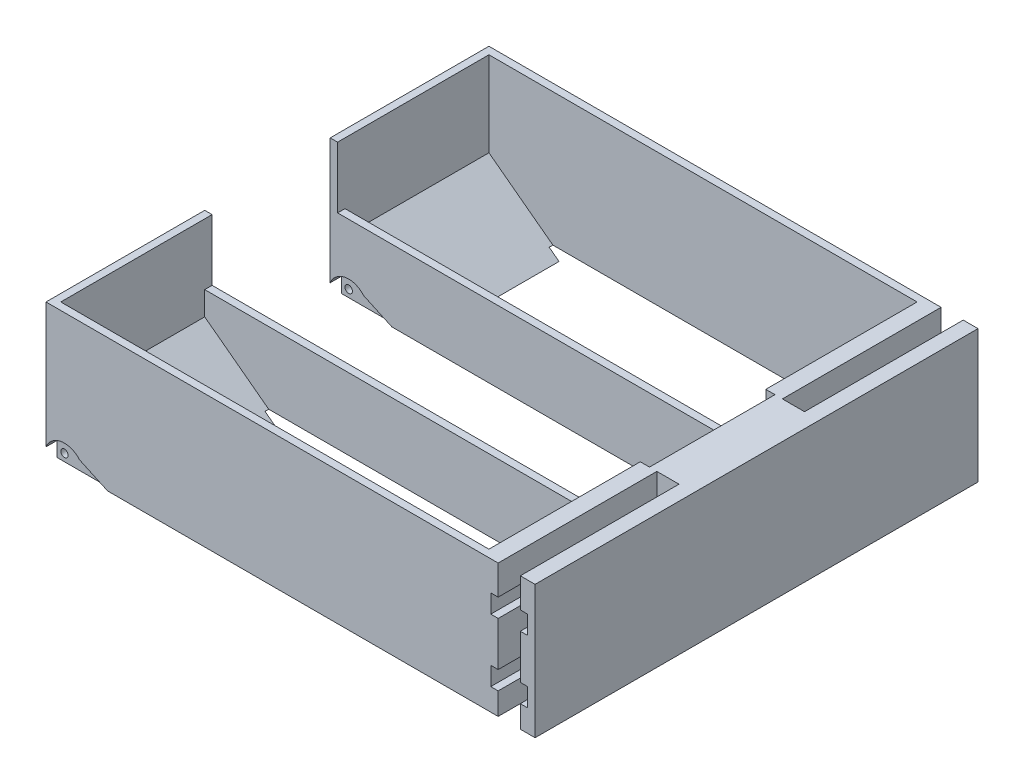
from build123d import *

# Parameters (mm, degrees)
SKETCH2_W            = 120
SKETCH2_H            = 43
BOSS_EXTRUDE1_DEPTH  = 38
SKETCH3_W            = 116
SKETCH3_H            = 39
CUT_EXTRUDE1_DEPTH   = 38
BOSS_EXTRUDE2_DEPTH  = 39
SKETCH5_W            = 43
SKETCH5_H            = 38
BOSS_EXTRUDE3_DEPTH  = 2.5
SKETCH6_W            = 2
SKETCH6_H            = 38
BOSS_EXTRUDE4_DEPTH  = 17
SKETCH7_W            = 34
SKETCH7_H            = 38
BOSS_EXTRUDE5_DEPTH  = 10
SKETCH8_W            = 4
SKETCH8_H            = 38
BOSS_EXTRUDE6_DEPTH  = 43
SKETCH9_W            = 10
SKETCH9_H            = 5
CUT_EXTRUDE2_DEPTH   = 41
SKETCH11_W           = 120
SKETCH11_H           = 2
CUT_EXTRUDE3_DEPTH   = 110.5
CUT_EXTRUDE4_DEPTH   = 3
MIRROR4_COPY_1_DEPTH = 3
CUT_EXTRUDE5_START   = -114
SKETCH13_R           = 1
CUT_EXTRUDE5_DEPTH   = 114
SKETCH14_W           = 116
SKETCH14_H           = 2
CUT_EXTRUDE6_DEPTH   = 16.6


with BuildPart() as part:
    # Sketch2 → Boss-Extrude1 (new body)
    with BuildSketch(Plane(origin=(0, 0, 0), x_dir=(1, 0, 0), z_dir=(0, 1, 0))):
        Rectangle(SKETCH2_W, SKETCH2_H)
    extrude(amount=BOSS_EXTRUDE1_DEPTH)

    # Sketch3 → Cut-Extrude1 (cut)
    with BuildSketch(Plane(origin=(0, 38, 0), x_dir=(1, 0, 0), z_dir=(0, 1, 0))):
        Rectangle(SKETCH3_W, SKETCH3_H)
    extrude(amount=-CUT_EXTRUDE1_DEPTH, mode=Mode.SUBTRACT)

    # Sketch4 → Boss-Extrude2 (add)
    with BuildSketch(Plane.XY.offset(-19.5)):
        Polygon((-58, 0), (-58, 15), (-38, 0), align=None)
    extrude(amount=BOSS_EXTRUDE2_DEPTH)

    # Sketch5 → Boss-Extrude3 (add)
    with BuildSketch(Plane(origin=(60, 0, 0), x_dir=(0, 0, -1), z_dir=(1, 0, 0))):
        with Locations((0, 19)):
            Rectangle(SKETCH5_W, SKETCH5_H)
    extrude(amount=BOSS_EXTRUDE3_DEPTH)

    # Sketch6 → Boss-Extrude4 (add)
    with BuildSketch(Plane(origin=(0, 0, -21.5), x_dir=(-1, 0, 0), z_dir=(0, 0, -1))):
        with Locations((-61.5, 19)):
            Rectangle(SKETCH6_W, SKETCH6_H)
    extrude(amount=BOSS_EXTRUDE4_DEPTH)

    # Mirror1: part across plane


with BuildPart() as part_1:
    add(part.part)
    add(part.part.mirror(Plane(origin=(0, 0, -38.5), x_dir=(1, 0, 0), z_dir=(0, 0, -1))))

    # Sketch7 → Boss-Extrude5 (add)
    with BuildSketch(Plane(origin=(62.5, 0, 0), x_dir=(0, 0, -1), z_dir=(1, 0, 0))):
        with Locations((38.5, 19)):
            Rectangle(SKETCH7_W, SKETCH7_H)
    extrude(amount=BOSS_EXTRUDE5_DEPTH)

    # Sketch8 → Boss-Extrude6 (add)
    with BuildSketch(Plane.XY.offset(-21.5)):
        with Locations((70.5, 19)):
            Rectangle(SKETCH8_W, SKETCH8_H)
    boss_extrude6 = extrude(amount=BOSS_EXTRUDE6_DEPTH)

    # Sketch9 → Cut-Extrude2 (cut)
    with BuildSketch(Plane.XY.offset(21.5)):
        with Locations((65.5, 27.5)):
            Rectangle(SKETCH9_W, SKETCH9_H)
        with Locations((65.5, 10.5)):
            Rectangle(SKETCH9_W, SKETCH9_H)
    cut_extrude2 = extrude(amount=-CUT_EXTRUDE2_DEPTH, mode=Mode.SUBTRACT)

    # Mirror2: Boss-Extrude6, Cut-Extrude2 across plane
    add(boss_extrude6.mirror(Plane(origin=(0, 0, -38.5), x_dir=(1, 0, 0), z_dir=(0, 0, -1))))
    add(cut_extrude2.mirror(Plane(origin=(0, 0, -38.5), x_dir=(1, 0, 0), z_dir=(0, 0, -1))), mode=Mode.SUBTRACT)

    # Sketch11 → Cut-Extrude3 (cut)
    with BuildSketch(Plane(origin=(72.5, 0, 0), x_dir=(0, 0, -1), z_dir=(1, 0, 0))):
        with Locations((38.5, 1)):
            Rectangle(SKETCH11_W, SKETCH11_H)
    extrude(amount=-CUT_EXTRUDE3_DEPTH, mode=Mode.SUBTRACT)

    # Sketch12 → Cut-Extrude4 (cut)
    with BuildSketch(Plane.XY.offset(21.5)):
        with BuildLine():
            Line((-38, 2), (-49.614835193, 2))
            ThreePointArc((-49.614835193, 2), (-56.018375168, 7.287996976), (-60, 0))
            Line((-60, 0), (-38, 0))
            Line((-38, 0), (-38, 2))
        make_face()
    cut_extrude4 = extrude(amount=-CUT_EXTRUDE4_DEPTH, mode=Mode.SUBTRACT)

    # Mirror3: Cut-Extrude4 across plane
    add(cut_extrude4.mirror(Plane.XY), mode=Mode.SUBTRACT)

    # Mirror4: Cut-Extrude4 across plane
    add(cut_extrude4.mirror(Plane(origin=(0, 0, -38.5), x_dir=(1, 0, 0), z_dir=(0, 0, -1))), mode=Mode.SUBTRACT)

    # Mirror4 copy 1 sketch → Mirror4 copy 1 (cut)
    with BuildSketch(Plane.XY.offset(-55.5)):
        with BuildLine():
            Line((-38, 2), (-49.614835193, 2))
            ThreePointArc((-49.614835193, 2), (-56.018375168, 7.287996976), (-60, 0))
            Line((-60, 0), (-38, 0))
            Line((-38, 0), (-38, 2))
        make_face()
    extrude(amount=-MIRROR4_COPY_1_DEPTH, mode=Mode.SUBTRACT)

    # Sketch13 → Cut-Extrude5 (cut)
    with BuildSketch(Plane.XY.offset(18.5).offset(CUT_EXTRUDE5_START)):
        with Locations((-58, 2)):
            Circle(SKETCH13_R)
    extrude(amount=CUT_EXTRUDE5_DEPTH, mode=Mode.SUBTRACT)

    # Chamfer1
    # the kernel refuses this chamfer: 10 mm, written as the material it takes off along each edge
    with BuildSketch(Plane(origin=(-49.614835193, 2, 38.180669666), x_dir=(-0.41152080336556635, 0.9114003666870882, 0), z_dir=(0, 0, -1))) as chamfer1_piece_1:
        with BuildLine():
            Line((4.024103798, 0), (-2.897424879, 6.010331734))
            Line((-2.897424879, 6.010331734), (-3.079704953, 5.928027573))
            ThreePointArc((-3.079704953, 5.928027573), (-1.554736759, 2.957293148), (-0.182280073, -0.082304161))
            Line((-0.182280073, -0.082304161), (0.082304161, -0.182280073))
            ThreePointArc((0.082304161, -0.182280073), (2.000716354, 0.27264804), (3.968173362, -0.192020276))
            Line((3.968173362, -0.192020276), (4.024103798, 0))
        make_face()
    extrude(amount=19.680669666, mode=Mode.SUBTRACT)

    # Chamfer2
    # the kernel refuses this chamfer: 10 mm, written as the material it takes off along each edge
    with BuildSketch(Plane(origin=(-49.614835193, 2, -38.180669666), x_dir=(0.9996854583228201, -0.0250795617564035, 0), z_dir=(0, 0, 1))) as chamfer2_piece_1:
        with BuildLine():
            Line((6.672267866, 0), (-1.747462586, 3.624884258))
            Line((-1.747462586, 3.624884258), (-1.896145364, 3.491117927))
            ThreePointArc((-1.896145364, 3.491117927), (-0.623209418, 1.920628258), (-0.199937092, -0.005015912))
            Line((-0.199937092, -0.005015912), (0.005015912, -0.199937092))
            ThreePointArc((0.005015912, -0.199937092), (3.339051469, -0.116294632), (6.677283779, -0.199937092))
            Line((6.677283779, -0.199937092), (6.672267866, 0))
        make_face()
    extrude(amount=19.680669666, mode=Mode.SUBTRACT)

    # Chamfer3
    # the kernel refuses this chamfer: 10 mm, written as the material it takes off along each edge
    with BuildSketch(Plane(origin=(-49.614835193, 2, -38.819330334), x_dir=(0.9996854583228201, -0.02507956175640344, 0), z_dir=(0, 0, -1))) as chamfer3_piece_1:
        with BuildLine():
            Line((6.672267866, 0), (-1.747462586, -3.624884258))
            Line((-1.747462586, -3.624884258), (-1.896145364, -3.491117927))
            ThreePointArc((-1.896145364, -3.491117927), (-0.623209418, -1.920628258), (-0.199937092, 0.005015912))
            Line((-0.199937092, 0.005015912), (0.005015912, 0.199937092))
            ThreePointArc((0.005015912, 0.199937092), (3.339051469, 0.116294632), (6.677283779, 0.199937092))
            Line((6.677283779, 0.199937092), (6.672267866, 0))
        make_face()
    extrude(amount=19.680669666, mode=Mode.SUBTRACT)

    # Chamfer4
    # the kernel refuses this chamfer: 10 mm, written as the material it takes off along each edge
    with BuildSketch(Plane(origin=(-49.614835193, 2, -115.180669666), x_dir=(0.9996854583228201, -0.0250795617564035, 0), z_dir=(0, 0, 1))) as chamfer4_piece_1:
        with BuildLine():
            Line((6.672267866, 0), (-1.747462586, 3.624884258))
            Line((-1.747462586, 3.624884258), (-1.896145364, 3.491117927))
            ThreePointArc((-1.896145364, 3.491117927), (-0.623209418, 1.920628258), (-0.199937092, -0.005015912))
            Line((-0.199937092, -0.005015912), (0.005015912, -0.199937092))
            ThreePointArc((0.005015912, -0.199937092), (3.339051469, -0.116294632), (6.677283779, -0.199937092))
            Line((6.677283779, -0.199937092), (6.672267866, 0))
        make_face()
    extrude(amount=19.680669666, mode=Mode.SUBTRACT)

    # Sketch14 → Cut-Extrude6 (cut)
    with BuildSketch(Plane(origin=(0, 38, 0), x_dir=(1, 0, 0), z_dir=(0, 1, 0))):
        with Locations((0, 20.5)):
            Rectangle(SKETCH14_W, SKETCH14_H)
    cut_extrude6 = extrude(amount=-CUT_EXTRUDE6_DEPTH, mode=Mode.SUBTRACT)

    # Mirror5: Cut-Extrude6 across plane
    add(cut_extrude6.mirror(Plane(origin=(0, 0, -38.5), x_dir=(1, 0, 0), z_dir=(0, 0, -1))), mode=Mode.SUBTRACT)


solid = part_1.part
